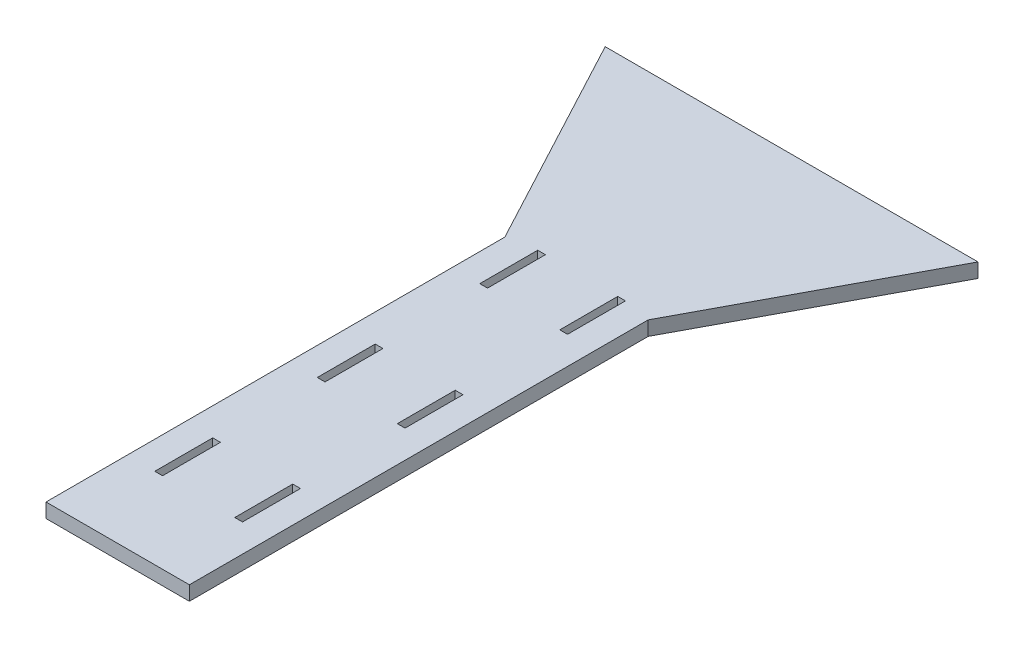
from build123d import *

# Parameters (mm, degrees)
BOSS_EXTRUDE1_DEPTH = 6.35
SKETCH2_W           = 3.429
SKETCH2_H           = 25.654
CUT_EXTRUDE1_DEPTH  = 310.721209316


with BuildPart() as part:
    # Sketch1 → Boss-Extrude1 (new body)
    with BuildSketch(Plane(origin=(0, 0, 0), x_dir=(1, 0, 0), z_dir=(0, 1, 0))):
        Polygon((-31.75, 0), (31.75, 0), (31.75, 203.2), (82.55, 298.45), (-82.55, 298.45), (-31.75, 203.2), align=None)
    extrude(amount=BOSS_EXTRUDE1_DEPTH)

    # Sketch2 → Cut-Extrude1 (cut, through all)
    with BuildSketch(Plane(origin=(0, 6.35, 0), x_dir=(1, 0, 0), z_dir=(0, 1, 0))):
        with Locations((-17.7165, 48.683333333)):
            Rectangle(SKETCH2_W, SKETCH2_H)
        with Locations((-17.7165, 120.65)):
            Rectangle(SKETCH2_W, SKETCH2_H)
        with Locations((-17.7165, 192.616666667)):
            Rectangle(SKETCH2_W, SKETCH2_H)
        with Locations((17.7165, 192.616666667)):
            Rectangle(SKETCH2_W, SKETCH2_H)
        with Locations((17.7165, 120.65)):
            Rectangle(SKETCH2_W, SKETCH2_H)
        with Locations((17.7165, 48.683333333)):
            Rectangle(SKETCH2_W, SKETCH2_H)
    extrude(amount=-CUT_EXTRUDE1_DEPTH, mode=Mode.SUBTRACT)


solid = part.part
